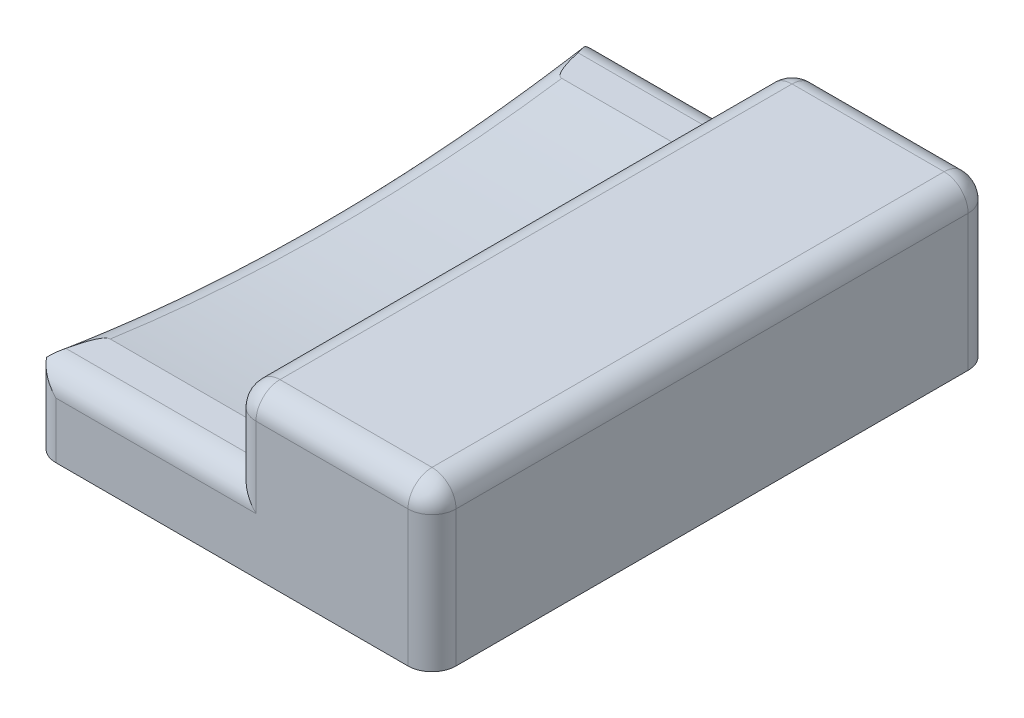
from build123d import *

# Parameters (mm, degrees)
SKETCH1_W           = 50
SKETCH1_H           = 70
BOSS_EXTRUDE1_DEPTH = 20
CUT_EXTRUDE1_DEPTH  = 25
FILLET1_R           = 3


with BuildPart() as part:
    # Sketch1 → Boss-Extrude1 (new body)
    with BuildSketch(Plane(origin=(0, 0, 0), x_dir=(1, 0, 0), z_dir=(0, 1, 0))):
        with Locations((25, 35)):
            Rectangle(SKETCH1_W, SKETCH1_H)
    extrude(amount=BOSS_EXTRUDE1_DEPTH)

    # Sketch3 → Cut-Extrude1 (cut)
    with BuildSketch(Plane.ZY):
        with BuildLine():
            Line((-70, 20), (0, 20))
            Line((0, 20), (0, 10))
            Line((0, 10), (-6.786528041, 10))
            ThreePointArc((-6.786528041, 10), (-35, 8), (-63.213471959, 10))
            Line((-63.213471959, 10), (-70, 10))
            Line((-70, 10), (-70, 20))
        make_face()
    extrude(amount=-CUT_EXTRUDE1_DEPTH, mode=Mode.SUBTRACT)

    # Fillet1
    # the kernel refuses this fillet: 3 mm, written as the material it takes off along each edge
    with BuildSketch(Plane(origin=(28, 17, -67), x_dir=(-1, 0, 0), z_dir=(0, 1, 0))) as fillet1_piece_1_section:
        Polygon((0, 0), (FILLET1_R, 0), (FILLET1_R, -FILLET1_R), (0, -FILLET1_R), align=None)
    fillet1_piece_1 = extrude(amount=FILLET1_R, mode=Mode.PRIVATE)
    fillet1_piece_1 = fillet1_piece_1 - Plane(origin=(28, 17, -67), x_dir=(0.7071067811865475, 0, 0.7071067811865475), z_dir=(0, 1, 0)) * Sphere(FILLET1_R, mode=Mode.PRIVATE)
    add(fillet1_piece_1, mode=Mode.SUBTRACT)
    with BuildSketch(Plane(origin=(28, 17, -3), x_dir=(0, 1, 0), z_dir=(0, 0, 1))) as fillet1_piece_2_section:
        Polygon((0, 0), (FILLET1_R, 0), (FILLET1_R, FILLET1_R), (0, FILLET1_R), align=None)
    fillet1_piece_2 = extrude(amount=FILLET1_R, mode=Mode.PRIVATE)
    fillet1_piece_2 = fillet1_piece_2 - Plane(origin=(28, 17, -3), x_dir=(0.7071067811865475, -0.7071067811865475, 0), z_dir=(0, 0, 1)) * Sphere(FILLET1_R, mode=Mode.PRIVATE)
    add(fillet1_piece_2, mode=Mode.SUBTRACT)
    with BuildSketch(Plane(origin=(47, 17, -67), x_dir=(0, 1, 0), z_dir=(1, 0, 0))) as fillet1_piece_3_section:
        Polygon((0, 0), (FILLET1_R, 0), (FILLET1_R, -FILLET1_R), (0, -FILLET1_R), align=None)
    fillet1_piece_3 = extrude(amount=FILLET1_R, mode=Mode.PRIVATE)
    fillet1_piece_3 = fillet1_piece_3 - Plane(origin=(47, 17, -67), x_dir=(0, -0.7071067811865475, 0.7071067811865475), z_dir=(1, 0, 0)) * Sphere(FILLET1_R, mode=Mode.PRIVATE)
    add(fillet1_piece_3, mode=Mode.SUBTRACT)
    with BuildSketch(Plane(origin=(47, 17, -3), x_dir=(1, 0, 0), z_dir=(0, 0, 1))) as fillet1_piece_4_section:
        Polygon((0, 0), (FILLET1_R, 0), (FILLET1_R, FILLET1_R), (0, FILLET1_R), align=None)
    fillet1_piece_4 = extrude(amount=FILLET1_R, mode=Mode.PRIVATE)
    fillet1_piece_4 = fillet1_piece_4 - Plane(origin=(47, 17, -3), x_dir=(-0.7071067811865475, -0.7071067811865475, 0), z_dir=(0, 0, 1)) * Sphere(FILLET1_R, mode=Mode.PRIVATE)
    add(fillet1_piece_4, mode=Mode.SUBTRACT)
    with BuildSketch(Plane(origin=(25, 10, -70), x_dir=(0, 0, 1), z_dir=(0, 1, 0))) as fillet1_piece_5:
        with BuildLine():
            CenterArc((FILLET1_R, FILLET1_R), FILLET1_R, 180, 90)
            Line((0, FILLET1_R), (0, 0))
            Line((0, 0), (FILLET1_R, 0))
        make_face()
    extrude(amount=7, mode=Mode.SUBTRACT)
    with BuildSketch(Plane(origin=(25, 17, 0), x_dir=(1, 0, 0), z_dir=(0, -1, 0))) as fillet1_piece_6:
        with BuildLine():
            CenterArc((FILLET1_R, -FILLET1_R), FILLET1_R, 90, 90)
            Line((0, -FILLET1_R), (0, 0))
            Line((0, 0), (FILLET1_R, 0))
        make_face()
    extrude(amount=7, mode=Mode.SUBTRACT)
    with BuildSketch(Plane(origin=(-7.5, 10, -70), x_dir=(0, -1, 0), z_dir=(1, 0, 0))) as fillet1_piece_7:
        with BuildLine():
            CenterArc((FILLET1_R, -FILLET1_R), FILLET1_R, 90, 90)
            Line((0, -FILLET1_R), (0, 0))
            Line((0, 0), (FILLET1_R, 0))
        make_face()
    extrude(amount=32.5, mode=Mode.SUBTRACT)
    with BuildSketch(Plane(origin=(0, 208, -35), x_dir=(0, -0.9840151144884159, 0.17808496415573608), z_dir=(0, 0.17808496415573608, 0.9840151144884159))) as fillet1_piece_8:
        with BuildLine():
            CenterArc((200 + FILLET1_R, FILLET1_R), FILLET1_R, 180, 90)
            Line((200, FILLET1_R), (200, 0))
            Line((200, 0), (200 + FILLET1_R, 0))
        make_face()
    revolve(axis=Axis((0, 208, -35), (1, 0, 0)), revolution_arc=20.516468422, mode=Mode.SUBTRACT)
    with BuildSketch(Plane(origin=(-7.5, 10, 0), x_dir=(0, -1, 0), z_dir=(1, 0, 0))) as fillet1_piece_9:
        with BuildLine():
            CenterArc((FILLET1_R, FILLET1_R), FILLET1_R, 180, 90)
            Line((0, FILLET1_R), (0, 0))
            Line((0, 0), (FILLET1_R, 0))
        make_face()
    extrude(amount=32.5, mode=Mode.SUBTRACT)
    with BuildSketch(Plane(origin=(47, 20, -70), x_dir=(0, 0, 1), z_dir=(-1, 0, 0))) as fillet1_piece_10:
        with BuildLine():
            CenterArc((FILLET1_R, -FILLET1_R), FILLET1_R, 90, 90)
            Line((0, -FILLET1_R), (0, 0))
            Line((0, 0), (FILLET1_R, 0))
        make_face()
    extrude(amount=19, mode=Mode.SUBTRACT)
    with BuildSketch(Plane(origin=(50, 20, -3), x_dir=(0, -1, 0), z_dir=(0, 0, -1))) as fillet1_piece_11:
        with BuildLine():
            CenterArc((FILLET1_R, FILLET1_R), FILLET1_R, 180, 90)
            Line((0, FILLET1_R), (0, 0))
            Line((0, 0), (FILLET1_R, 0))
        make_face()
    extrude(amount=64, mode=Mode.SUBTRACT)
    with BuildSketch(Plane(origin=(28, 20, 0), x_dir=(0, -1, 0), z_dir=(1, 0, 0))) as fillet1_piece_12:
        with BuildLine():
            CenterArc((FILLET1_R, FILLET1_R), FILLET1_R, 180, 90)
            Line((0, FILLET1_R), (0, 0))
            Line((0, 0), (FILLET1_R, 0))
        make_face()
    extrude(amount=19, mode=Mode.SUBTRACT)
    with BuildSketch(Plane(origin=(25, 20, -67), x_dir=(1, 0, 0), z_dir=(0, 0, 1))) as fillet1_piece_13:
        with BuildLine():
            CenterArc((FILLET1_R, -FILLET1_R), FILLET1_R, 90, 90)
            Line((0, -FILLET1_R), (0, 0))
            Line((0, 0), (FILLET1_R, 0))
        make_face()
    extrude(amount=64, mode=Mode.SUBTRACT)
    with BuildSketch(Plane(origin=(0, -7.5, 0), x_dir=(1, 0, 0), z_dir=(0, 1, 0)), Plane(origin=(0, -7.5, -70), x_dir=(0, 0, 1), z_dir=(0, 1, 0))) as fillet1_piece_14:
        with BuildLine():
            CenterArc((FILLET1_R, FILLET1_R), FILLET1_R, 180, 90)
            Line((0, FILLET1_R), (0, 0))
            Line((0, 0), (FILLET1_R, 0))
        make_face()
    extrude(amount=25, mode=Mode.SUBTRACT)
    with BuildSketch(Plane(origin=(50, -7.5, -70), x_dir=(0, 0, 1), z_dir=(0, 1, 0)), Plane(origin=(50, -7.5, 0), x_dir=(-1, 0, 0), z_dir=(0, 1, 0))) as fillet1_piece_15:
        with BuildLine():
            CenterArc((FILLET1_R, -FILLET1_R), FILLET1_R, 90, 90)
            Line((0, -FILLET1_R), (0, 0))
            Line((0, 0), (FILLET1_R, 0))
        make_face()
    extrude(amount=24.5, mode=Mode.SUBTRACT)
    with BuildSketch(Plane(origin=(25, 2.5, -70), x_dir=(0, 0, 1), z_dir=(0, 1, 0))) as fillet1_piece_16a_section:
        with BuildLine():
            CenterArc((FILLET1_R, FILLET1_R), FILLET1_R, 180, 90)
            Line((0, FILLET1_R), (0, 0))
            Line((0, 0), (FILLET1_R, 0))
        make_face()
    fillet1_piece_16a = extrude(amount=14.5, mode=Mode.PRIVATE)
    fillet1_piece_16a = split(fillet1_piece_16a, bisect_by=Plane(origin=(25.679185343, 10, -69.320814657), z_dir=(0, -1, 0)), keep=Keep.TOP, mode=Mode.PRIVATE)
    with BuildSketch(Plane(origin=(-7.5, 10, -70), x_dir=(0, -1, 0), z_dir=(1, 0, 0))) as fillet1_piece_16b_section:
        with BuildLine():
            CenterArc((FILLET1_R, -FILLET1_R), FILLET1_R, 90, 90)
            Line((0, -FILLET1_R), (0, 0))
            Line((0, 0), (FILLET1_R, 0))
        make_face()
    fillet1_piece_16b = extrude(amount=40, mode=Mode.PRIVATE)
    fillet1_piece_16b = split(fillet1_piece_16b, bisect_by=Plane(origin=(25, 9.320814657, -69.320814657), z_dir=(1, 0, 0)), keep=Keep.TOP, mode=Mode.PRIVATE)
    fillet1_piece_16 = fillet1_piece_16a & fillet1_piece_16b
    add(fillet1_piece_16, mode=Mode.SUBTRACT)
    with BuildSketch(Plane(origin=(25, 17, 0), x_dir=(1, 0, 0), z_dir=(0, -1, 0))) as fillet1_piece_17a_section:
        with BuildLine():
            CenterArc((FILLET1_R, -FILLET1_R), FILLET1_R, 90, 90)
            Line((0, -FILLET1_R), (0, 0))
            Line((0, 0), (FILLET1_R, 0))
        make_face()
    fillet1_piece_17a = extrude(amount=14.5, mode=Mode.PRIVATE)
    fillet1_piece_17a = split(fillet1_piece_17a, bisect_by=Plane(origin=(25.679185343, 10, -0.679185343), z_dir=(0, -1, 0)), keep=Keep.TOP, mode=Mode.PRIVATE)
    with BuildSketch(Plane(origin=(-7.5, 10, 0), x_dir=(0, -1, 0), z_dir=(1, 0, 0))) as fillet1_piece_17b_section:
        with BuildLine():
            CenterArc((FILLET1_R, FILLET1_R), FILLET1_R, 180, 90)
            Line((0, FILLET1_R), (0, 0))
            Line((0, 0), (FILLET1_R, 0))
        make_face()
    fillet1_piece_17b = extrude(amount=40, mode=Mode.PRIVATE)
    fillet1_piece_17b = split(fillet1_piece_17b, bisect_by=Plane(origin=(25, 9.320814657, -0.679185343), z_dir=(1, 0, 0)), keep=Keep.TOP, mode=Mode.PRIVATE)
    fillet1_piece_17 = fillet1_piece_17a & fillet1_piece_17b
    add(fillet1_piece_17, mode=Mode.SUBTRACT)


solid = part.part
